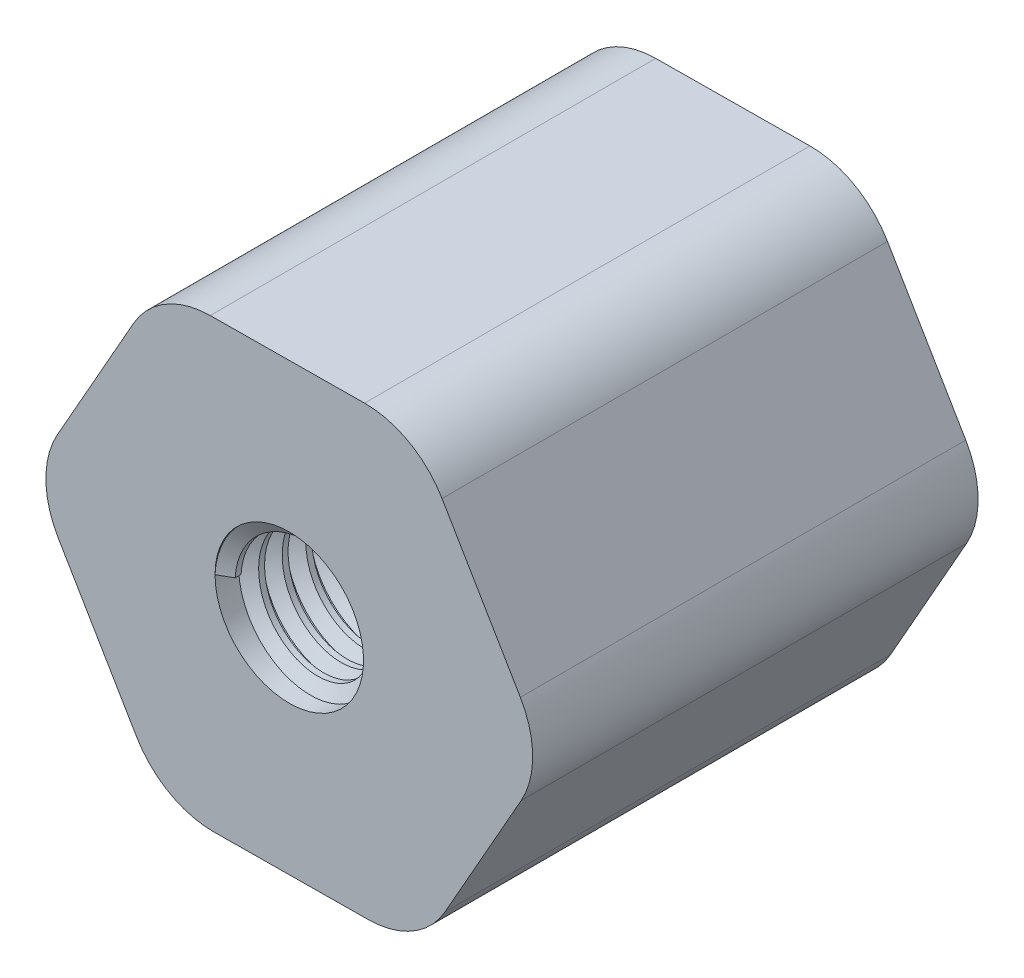
from build123d import *

# Parameters (mm, degrees)
CROQUIS1_R              = 2.5
SALIENTE_EXTRUIR1_DEPTH = 15
ROSCA1_PITCH            = 0.79375


with BuildPart() as part:
    # Croquis1 → Saliente-Extruir1 (new body)
    with BuildSketch(Plane.XY):
        with BuildLine():
            Line((2.534265047, 7.52180169), (-2.661699853, 7.477656979))
            ThreePointArc((-2.661699853, 7.477656979), (-4.158231115, 7.063004214), (-5.246938823, 5.955638756))
            Line((-5.246938823, 5.955638756), (-7.806690831, 1.433728799))
            ThreePointArc((-7.806690831, 1.433728799), (-8.195856634, -0.069631673), (-7.78120387, -1.566162934))
            Line((-7.78120387, -1.566162934), (-5.144990978, -6.043928179))
            ThreePointArc((-5.144990978, -6.043928179), (-4.037625519, -7.132635887), (-2.534265047, -7.52180169))
            Line((-2.534265047, -7.52180169), (2.661699853, -7.477656979))
            ThreePointArc((2.661699853, -7.477656979), (4.158231115, -7.063004214), (5.246938823, -5.955638756))
            Line((5.246938823, -5.955638756), (7.806690831, -1.433728799))
            ThreePointArc((7.806690831, -1.433728799), (8.195856634, 0.069631673), (7.78120387, 1.566162934))
            Line((7.78120387, 1.566162934), (5.144990978, 6.043928179))
            ThreePointArc((5.144990978, 6.043928179), (4.037625519, 7.132635887), (2.534265047, 7.52180169))
        make_face()
        Circle(CROQUIS1_R, mode=Mode.SUBTRACT)
    extrude(amount=SALIENTE_EXTRUIR1_DEPTH)

    # Rosca1: the profile of Perfil de rosca2 profile screwed along a right-hand helix of 18.015748 turns, 8 arcs to a turn; built about Z, then put on its axis
    rosca1_z = Axis((0, 0, 0), (0, 0, 1))
    rosca1_corners = [(2.5003, 0, -0.000173205), (2.5003, 0, 0.694704453), (2.070370212, 0, 0.446484374), (2.070370212, 0, 0.248046874)]
    with BuildLine(mode=Mode.PRIVATE) as rosca1_profile:
        Line(rosca1_corners[0], rosca1_corners[1])
        Line(rosca1_corners[1], rosca1_corners[2])
        Line(rosca1_corners[2], rosca1_corners[3])
        Line(rosca1_corners[3], rosca1_corners[0])
    rosca1_cap = Face(rosca1_profile.wire())
    rosca1_turn_angles = [0, 22.5, 45, 67.5, 90, 112.5, 135, 157.5, 180, 202.5, 225, 247.5, 270, 292.5, 315, 337.5, 360]
    rosca1_turn_weights = [1, 0.9238795325112867, 1, 0.9238795325112867, 1, 0.9238795325112867, 1, 0.9238795325112867, 1, 0.9238795325112867, 1, 0.9238795325112867, 1, 0.9238795325112867, 1, 0.9238795325112867, 1]
    rosca1_turn_rails = [Edge.make_bspline([Vector(p[0], p[1], 0).rotate(rosca1_z, rosca1_turn_angles[k]) / rosca1_turn_weights[k] + Vector(0, 0, p[2] + ROSCA1_PITCH * rosca1_turn_angles[k] / 360) for k in range(17)], [0, 0, 0, 1, 1, 2, 2, 3, 3, 4, 4, 5, 5, 6, 6, 7, 7, 8, 8, 8], 2, rosca1_turn_weights) for p in rosca1_corners]
    rosca1_turn_sides = [Face.make_surface_from_curves(rosca1_turn_rails[p[0]], rosca1_turn_rails[p[1]]) for p in [(0, 1), (1, 2), (2, 3), (3, 0)]]
    rosca1_last_angles = [6480, 6482.834645669, 6485.669291339]
    rosca1_last_weights = [1, 0.998776416214261, 1]
    rosca1_last_rails = [Edge.make_bspline([Vector(p[0], p[1], 0).rotate(rosca1_z, rosca1_last_angles[k]) / rosca1_last_weights[k] + Vector(0, 0, p[2] + ROSCA1_PITCH * rosca1_last_angles[k] / 360) for k in range(3)], [0, 0, 0, 1, 1, 1], 2, rosca1_last_weights) for p in rosca1_corners]
    rosca1_last_sides = [Face.make_surface_from_curves(rosca1_last_rails[p[0]], rosca1_last_rails[p[1]]) for p in [(0, 1), (1, 2), (2, 3), (3, 0)]]
    rosca1 = Plane(origin=(0, 0, 15), x_dir=(-1, 0, 0), z_dir=(0, 0, -1)) * Solid(Shell([*[p.moved(Location((0, 0, ROSCA1_PITCH * i))) for i in range(18) for p in rosca1_turn_sides], *rosca1_last_sides, rosca1_cap, rosca1_cap.rotate(rosca1_z, 6485.669291339).moved(Location((0, 0, ROSCA1_PITCH * 6485.669291339 / 360)))]))
    add(rosca1)


solid = part.part
